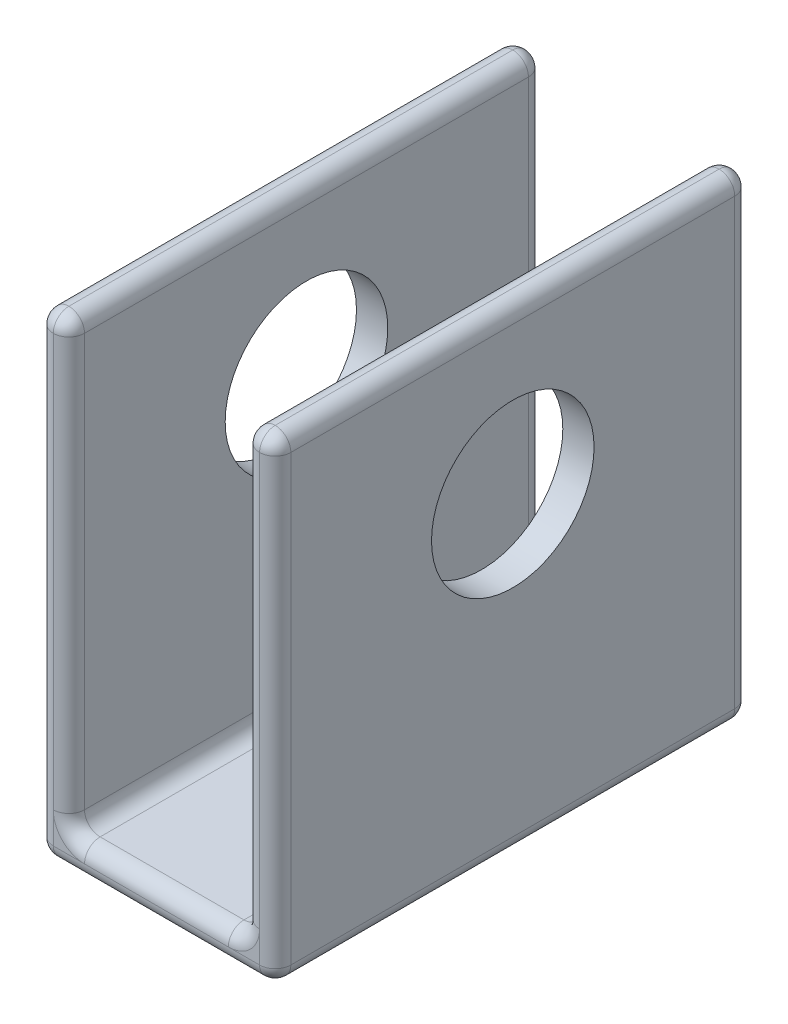
from build123d import *

# Parameters (mm, degrees)
BOSS_EXTRUDE1_DEPTH = 38
SKETCH2_R           = 6.5
CUT_EXTRUDE1_DEPTH  = 58
FILLET1_R           = 1.25


with BuildPart() as part:
    # Sketch1 → Boss-Extrude1 (new body)
    with BuildSketch(Plane.XY):
        with BuildLine():
            Line((-9.5, 0), (9.5, 0))
            Line((9.5, 0), (9.5, 38))
            Line((9.5, 38), (8.25, 38))
            ThreePointArc((8.25, 38), (7.366116524, 37.633883476), (7, 36.75))
            Line((7, 36.75), (7, 2.5))
            Line((7, 2.5), (-7, 2.5))
            Line((-7, 2.5), (-7, 36.75))
            ThreePointArc((-7, 36.75), (-7.366116524, 37.633883476), (-8.25, 38))
            Line((-8.25, 38), (-9.5, 38))
            Line((-9.5, 38), (-9.5, 0))
        make_face()
    extrude(amount=BOSS_EXTRUDE1_DEPTH)

    # Sketch2 → Cut-Extrude1 (cut, through all)
    with BuildSketch(Plane(origin=(9.5, 0, 0), x_dir=(0, 0, -1), z_dir=(1, 0, 0))):
        with Locations((-19, 25)):
            Circle(SKETCH2_R)
    extrude(amount=-CUT_EXTRUDE1_DEPTH, mode=Mode.SUBTRACT)

    # Fillet1
    fillet1_edges = [part.edges().sort_by_distance(p)[0] for p in [
        (-7.366116524, 37.633883476, 0),
        (7.366116524, 37.633883476, 0),
        (7.366116524, 37.633883476, 38),
        (-7.366116524, 37.633883476, 38),
        (-9.5, 0, 19),
        (7, 2.5, 19),
        (-7, 2.5, 19),
        (-7, 19.625, 0),
        (-9.5, 19, 0),
        (0, 0, 0),
        (0, 2.5, 0),
        (7, 19.625, 0),
        (9.5, 19, 0),
        (9.5, 0, 19),
        (0, 0, 38),
        (-9.5, 19, 38),
        (-9.5, 38, 19),
        (9.5, 38, 19),
        (9.5, 19, 38),
        (7, 19.625, 38),
        (-7, 19.625, 38),
        (0, 2.5, 38),
    ]]
    fillet(fillet1_edges, radius=FILLET1_R - 0.0001)  # a hair under: the kernel refuses the full size


solid = part.part
